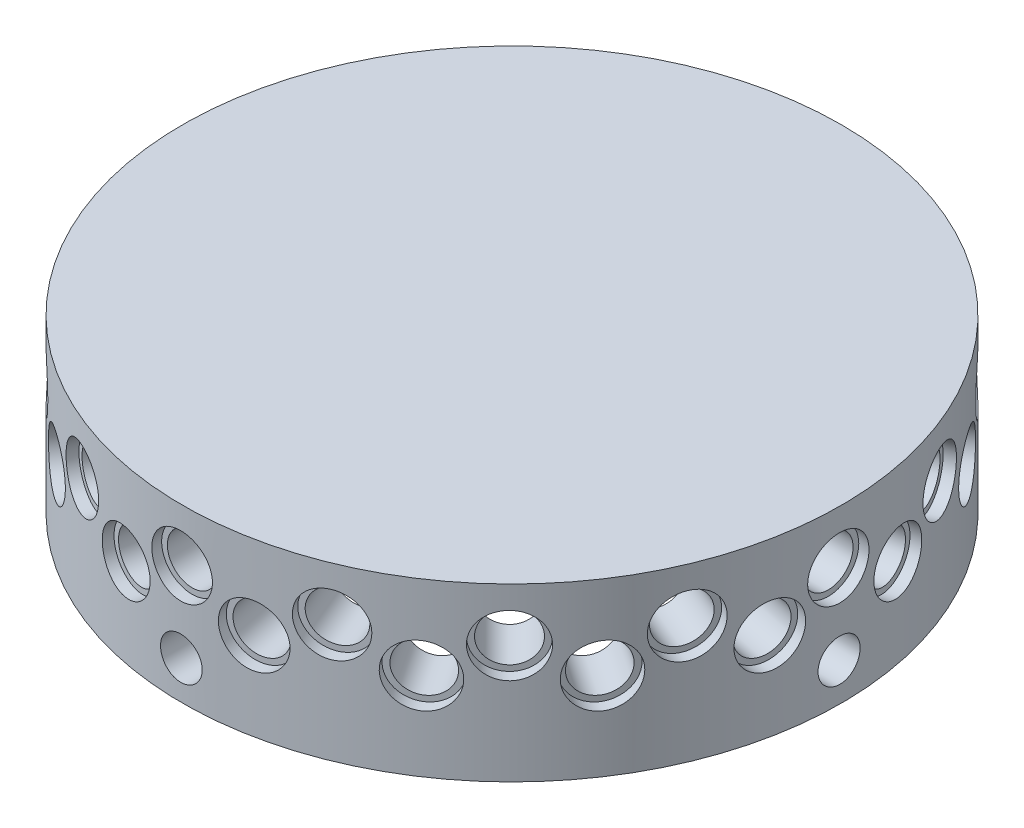
from build123d import *

# Parameters (mm, degrees)
SZKIC2_R                   = 8
SZKIC2_R_2                 = 6.5
WYTNIJ_WYCI_GNI_CIE2_DEPTH = 3
SZKIC3_R                   = 6.5
WYTNIJ_WYCI_GNI_CIE3_DEPTH = 30
SZYK_KO_OWY1_COUNT         = 16
SZKIC4_R                   = 5.5
WYTNIJ_WYCI_GNI_CIE4_DEPTH = 30
SZYK_KO_OWY2_COUNT         = 4
SZKIC8_R                   = 8
SZKIC8_R_2                 = 6.5
WYTNIJ_WYCI_GNI_CIE5_DEPTH = 3
SZKIC9_R                   = 6.5
WYTNIJ_WYCI_GNI_CIE6_DEPTH = 30
SZYK_KO_OWY3_COUNT         = 16


with BuildPart() as part:
    # Szkic1 → Obrót1 (revolve)
    with BuildSketch(Plane.XY):
        Polygon((0, 70.848451872), (-86.5, 70.848451872), (-86.5, 40.848451872), (-86.5, 25.848451872), (-70.5, 25.848451872), (-70.5, 65.848451872), (0, 65.848451872), align=None)
    revolve(axis=Axis((0, -200.62943078, 0), (0, 1, 0)))

    # Szkic2 → Wytnij-wyciągnięcie2 (cut)
    with BuildSketch(Plane(origin=(86.5, 0, 0), x_dir=(0, 0, -1), z_dir=(1, 0, 0))):
        with Locations((-0.467069002, 56.848451872)):
            Circle(SZKIC2_R)
        with Locations((-0.467069002, 56.848451872)):
            Circle(SZKIC2_R_2, mode=Mode.SUBTRACT)
    wytnij_wyci_gni_cie2 = extrude(amount=-WYTNIJ_WYCI_GNI_CIE2_DEPTH, mode=Mode.SUBTRACT)

    # Szkic3 → Wytnij-wyciągnięcie3 (cut)
    with BuildSketch(Plane(origin=(86.5, 0, 0), x_dir=(0, 0, -1), z_dir=(1, 0, 0))):
        with Locations((-0.467069002, 56.848451872)):
            Circle(SZKIC3_R)
    wytnij_wyci_gni_cie3 = extrude(amount=-WYTNIJ_WYCI_GNI_CIE3_DEPTH, mode=Mode.SUBTRACT)

    # Szyk kołowy1: Wytnij-wyciągnięcie2, Wytnij-wyciągnięcie3 ×16 about axis
    szyk_ko_owy1_axis = Axis((0, 0, 0), (0, -1, 0))
    add([wytnij_wyci_gni_cie2.rotate(szyk_ko_owy1_axis, i * 360 / SZYK_KO_OWY1_COUNT) for i in range(1, SZYK_KO_OWY1_COUNT)], mode=Mode.SUBTRACT)
    add([wytnij_wyci_gni_cie3.rotate(szyk_ko_owy1_axis, i * 360 / SZYK_KO_OWY1_COUNT) for i in range(1, SZYK_KO_OWY1_COUNT)], mode=Mode.SUBTRACT)

    # Szkic4 → Wytnij-wyciągnięcie4 (cut)
    with BuildSketch(Plane(origin=(86.5, 0, 0), x_dir=(0, 0, -1), z_dir=(1, 0, 0))):
        with Locations((-0.467069002, 35.848451872)):
            Circle(SZKIC4_R)
    wytnij_wyci_gni_cie4 = extrude(amount=-WYTNIJ_WYCI_GNI_CIE4_DEPTH, mode=Mode.SUBTRACT)

    # Szyk kołowy2: Wytnij-wyciągnięcie4 ×4 about axis
    szyk_ko_owy2_axis = Axis((0, -200.62943078, 0), (0, -1, 0))
    for i in range(1, SZYK_KO_OWY2_COUNT):
        add(wytnij_wyci_gni_cie4.rotate(szyk_ko_owy2_axis, i * 360 / SZYK_KO_OWY2_COUNT), mode=Mode.SUBTRACT)

    # Szkic8 → Wytnij-wyciągnięcie5 (cut)
    with BuildSketch(Plane(origin=(84.837926755, 0, 16.875312854), x_dir=(0, -1, 0), z_dir=(0.9807852804032304, 0, 0.19509032201612872))):
        with Locations((-48.848451872, 0)):
            Circle(SZKIC8_R)
        with Locations((-48.848451872, 0)):
            Circle(SZKIC8_R_2, mode=Mode.SUBTRACT)
    wytnij_wyci_gni_cie5 = extrude(amount=-WYTNIJ_WYCI_GNI_CIE5_DEPTH, mode=Mode.SUBTRACT)

    # Szkic9 → Wytnij-wyciągnięcie6 (cut)
    with BuildSketch(Plane(origin=(84.837926755, 0, 16.875312854), x_dir=(0, -1, 0), z_dir=(0.9807852804032304, 0, 0.19509032201612872))):
        with Locations((-48.848451872, 0)):
            Circle(SZKIC9_R)
    wytnij_wyci_gni_cie6 = extrude(amount=-WYTNIJ_WYCI_GNI_CIE6_DEPTH, mode=Mode.SUBTRACT)

    # Szyk kołowy3: Wytnij-wyciągnięcie5, Wytnij-wyciągnięcie6 ×16 about axis
    szyk_ko_owy3_axis = Axis((0, -200.62943078, 0), (0, -1, 0))
    add([wytnij_wyci_gni_cie5.rotate(szyk_ko_owy3_axis, i * 360 / SZYK_KO_OWY3_COUNT) for i in range(1, SZYK_KO_OWY3_COUNT)], mode=Mode.SUBTRACT)
    add([wytnij_wyci_gni_cie6.rotate(szyk_ko_owy3_axis, i * 360 / SZYK_KO_OWY3_COUNT) for i in range(1, SZYK_KO_OWY3_COUNT)], mode=Mode.SUBTRACT)


solid = part.part
